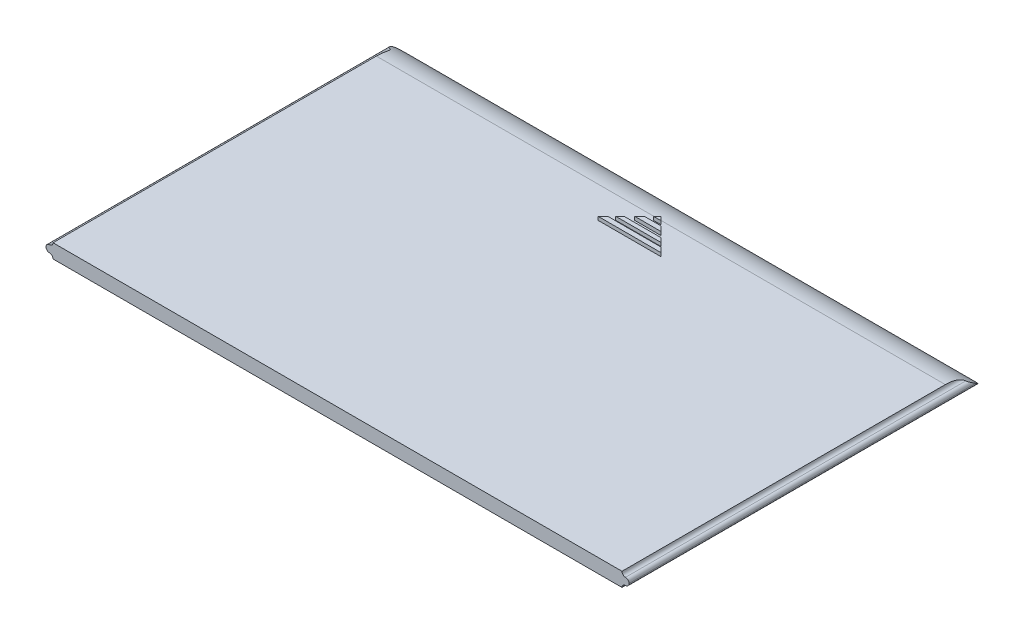
from build123d import *

# Parameters (mm, degrees)
SKETCH1_W           = 81
SKETCH1_H           = 50.5
BOSS_EXTRUDE1_DEPTH = 2
SKETCH2_W           = 50.5
SKETCH2_H           = 1
EXTRUDE_THIN1_DEPTH = 1
FILLET4_START       = -26
FILLET4_DEPTH       = 52
FILLET4_START_2     = -25.25
FILLET4_2_DEPTH     = 50.5
FILLET8_R           = 6
BOSS_EXTRUDE2_DEPTH = 0.5


with BuildPart() as part:
    # Sketch1 → Boss-Extrude1 (new body)
    with BuildSketch(Plane(origin=(0, 0, 0), x_dir=(1, 0, 0), z_dir=(0, 1, 0))):
        Rectangle(SKETCH1_W, SKETCH1_H)
    extrude(amount=BOSS_EXTRUDE1_DEPTH)

    # Sketch2 → Extrude-Thin1 (add)
    with BuildSketch(Plane(origin=(40.5, 0, 0), x_dir=(0, 0, -1), z_dir=(1, 0, 0))):
        with Locations((0, 1)):
            Rectangle(SKETCH2_W, SKETCH2_H)
    extrude_thin1 = extrude(amount=EXTRUDE_THIN1_DEPTH)

    # Mirror1: Extrude-Thin1 across plane
    add(extrude_thin1.mirror(Plane(origin=(0, 0, 0), x_dir=(0, 0, 1), z_dir=(1, 0, 0))))

    # Fillet4: read off the stored shape, not the designer's step
    # Fillet4 outline → Fillet4 (cut)
    with BuildSketch(Plane.XY.offset(FILLET4_START)):
        with BuildLine():
            Line((-41.5, 0.5), (-41, 0.5))
            ThreePointArc((-41, 0.5), (-41.353553391, 0.646446609), (-41.5, 1))
            Line((-41.5, 1), (-41.5, 0.5))
        make_face()
        with BuildLine():
            Line((-41.5, 1.5), (-41.5, 1))
            ThreePointArc((-41.5, 1), (-41.353553391, 1.353553391), (-41, 1.5))
            Line((-41, 1.5), (-41.5, 1.5))
        make_face()
        with BuildLine():
            Line((41.5, 1.5), (41, 1.5))
            ThreePointArc((41, 1.5), (41.353553391, 1.353553391), (41.5, 1))
            Line((41.5, 1), (41.5, 1.5))
        make_face()
        with BuildLine():
            Line((41.5, 0.5), (41.5, 1))
            ThreePointArc((41.5, 1), (41.353553391, 0.646446609), (41, 0.5))
            Line((41, 0.5), (41.5, 0.5))
        make_face()
    extrude(amount=FILLET4_DEPTH, mode=Mode.SUBTRACT)

    # Fillet4 2 outline → Fillet4 2 (add)
    with BuildSketch(Plane.XY.offset(FILLET4_START_2)):
        with BuildLine():
            Line((-40.5, 0.5), (-41, 0.5))
            ThreePointArc((-41, 0.5), (-40.646446609, 0.353553391), (-40.5, 0))
            Line((-40.5, 0), (-40.5, 0.5))
        make_face()
        with BuildLine():
            ThreePointArc((-40.5, 2), (-40.646446609, 1.646446609), (-41, 1.5))
            Line((-41, 1.5), (-40.5, 1.5))
            Line((-40.5, 1.5), (-40.5, 2))
        make_face()
        with BuildLine():
            Line((40.5, 1.5), (41, 1.5))
            ThreePointArc((41, 1.5), (40.646446609, 1.646446609), (40.5, 2))
            Line((40.5, 2), (40.5, 1.5))
        make_face()
        with BuildLine():
            ThreePointArc((40.5, 0), (40.646446609, 0.353553391), (41, 0.5))
            Line((41, 0.5), (40.5, 0.5))
            Line((40.5, 0.5), (40.5, 0))
        make_face()
    extrude(amount=FILLET4_2_DEPTH)

    # Fillet8
    # the kernel refuses this fillet: 6 mm, written as the material it takes off along each edge
    with BuildSketch(Plane(origin=(-51.680339887, 2, -25.25), x_dir=(0, -1, 0), z_dir=(1, 0, 0))) as fillet8_piece_1:
        with BuildLine():
            CenterArc((6, -4.472135955), FILLET8_R, 131.810314896, 48.189685104)
            Line((0, -4.472135955), (-0.12, -4.472135955))
            Line((-0.12, -4.472135955), (-0.12, 0))
            Line((-0.12, 0), (0, 0.12))
            ThreePointArc((0, 0.12), (1, 0.12), (1.92, 0.089442719))
            Line((1.92, 0.089442719), (2, 0))
        make_face()
    extrude(amount=103.360679775, mode=Mode.SUBTRACT)

    # Sketch3 → Boss-Extrude2 (add)
    with BuildSketch(Plane(origin=(0, 2, 0), x_dir=(1, 0, 0), z_dir=(0, 1, 0))):
        Polygon((0, 20.777864045), (-0.527934032, 20.249930013), (0.527934032, 20.249930013), align=None)
        Polygon((-4.470357419, 16.307506626), (4.470357419, 16.307506626), (3.779119733, 16.998744312), (-3.779119733, 16.998744312), align=None)
        Polygon((-1.175607402, 19.602256643), (1.175607402, 19.602256643), (1.863999283, 18.913864762), (-1.863999283, 18.913864762), align=None)
        Polygon((-2.621779089, 18.156084956), (2.621779089, 18.156084956), (3.215777687, 17.562086358), (-3.215777687, 17.562086358), align=None)
    extrude(amount=BOSS_EXTRUDE2_DEPTH)


solid = part.part
